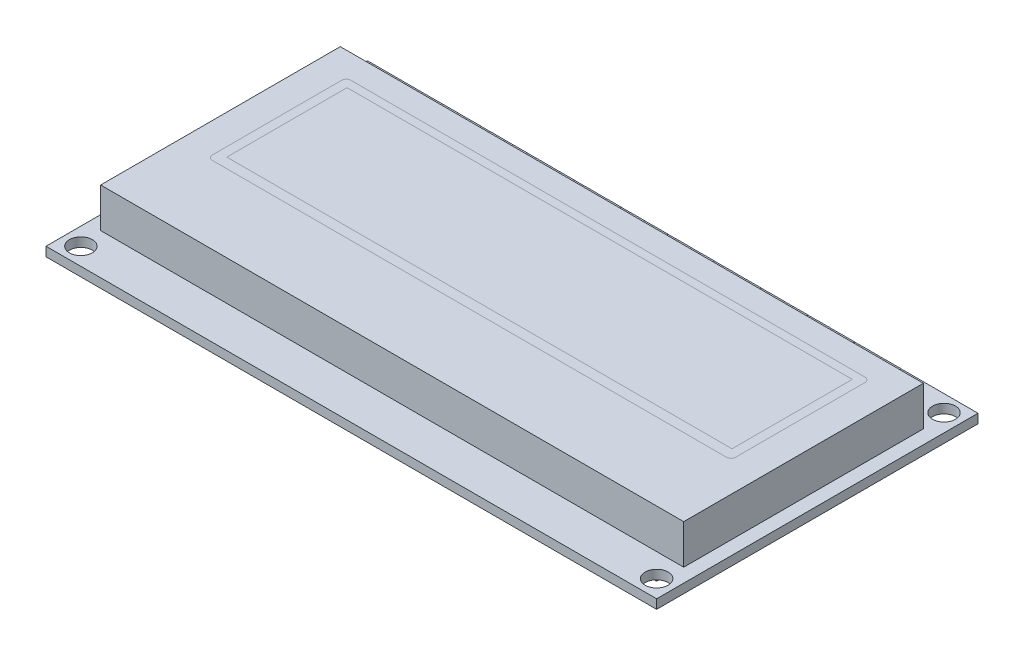
from build123d import *
from build123d.topology import SkipClean

# Parameters (mm, degrees)
SKETCH2_W                  = 66.5
SKETCH2_H                  = 35
BOSS_EXTRUDE1_DEPTH        = 0.5
F_2_5_2_5_DIAMETER_HOLE1_D = 2.5
F_0_8_0_8_DIAMETER_HOLE1_D = 0.8
SKETCH8_R                  = 0.4
BOSS_EXTRUDE2_DEPTH        = 0.01
LPATTERN1_COUNT            = 20
LPATTERN1_PITCH            = 2.54
MIRROR3_COPY_1_SKETCH_R    = 0.4
MIRROR3_COPY_1_DEPTH       = 0.01
MIRROR3_COPY_2_SKETCH_R    = 0.4
MIRROR3_COPY_2_DEPTH       = 0.01
MIRROR3_COPY_3_SKETCH_R    = 0.4
MIRROR3_COPY_3_DEPTH       = 0.01
MIRROR3_COPY_4_SKETCH_R    = 0.4
MIRROR3_COPY_4_DEPTH       = 0.01
MIRROR3_COPY_5_SKETCH_R    = 0.4
MIRROR3_COPY_5_DEPTH       = 0.01
MIRROR3_COPY_6_SKETCH_R    = 0.4
MIRROR3_COPY_6_DEPTH       = 0.01
MIRROR3_COPY_7_SKETCH_R    = 0.4
MIRROR3_COPY_7_DEPTH       = 0.01
MIRROR3_COPY_8_SKETCH_R    = 0.4
MIRROR3_COPY_8_DEPTH       = 0.01
MIRROR3_COPY_9_SKETCH_R    = 0.4
MIRROR3_COPY_9_DEPTH       = 0.01
MIRROR3_COPY_10_SKETCH_R   = 0.4
MIRROR3_COPY_10_DEPTH      = 0.01
MIRROR3_COPY_11_SKETCH_R   = 0.4
MIRROR3_COPY_11_DEPTH      = 0.01
MIRROR3_COPY_12_SKETCH_R   = 0.4
MIRROR3_COPY_12_DEPTH      = 0.01
MIRROR3_COPY_13_SKETCH_R   = 0.4
MIRROR3_COPY_13_DEPTH      = 0.01
MIRROR3_COPY_14_SKETCH_R   = 0.4
MIRROR3_COPY_14_DEPTH      = 0.01
MIRROR3_COPY_15_SKETCH_R   = 0.4
MIRROR3_COPY_15_DEPTH      = 0.01
MIRROR3_COPY_16_SKETCH_R   = 0.4
MIRROR3_COPY_16_DEPTH      = 0.01
MIRROR3_COPY_17_SKETCH_R   = 0.4
MIRROR3_COPY_17_DEPTH      = 0.01
MIRROR3_COPY_18_SKETCH_R   = 0.4
MIRROR3_COPY_18_DEPTH      = 0.01
MIRROR3_COPY_19_SKETCH_R   = 0.4
MIRROR3_COPY_19_DEPTH      = 0.01
SKETCH10_W                 = 63.5
SKETCH10_H                 = 26.1
BOSS_EXTRUDE3_DEPTH        = 4.3
SKETCH13_W                 = 56.2
SKETCH13_H                 = 24.45
BOSS_EXTRUDE4_DEPTH        = 2.5


with BuildPart() as part:
    # Sketch2 → Boss-Extrude1 (new, symmetric)
    with BuildSketch(Plane(origin=(0, 0, 0), x_dir=(1, 0, 0), z_dir=(0, 1, 0))):
        Rectangle(SKETCH2_W, SKETCH2_H)
    extrude(amount=BOSS_EXTRUDE1_DEPTH, both=True)

    # Ø2.5 (2.5) Diameter Hole1 (through all)
    with Locations(Plane(origin=(0, 0.5, 0), x_dir=(1, 0, 0), z_dir=(0, 1, 0))):
        with Locations((-31.35, -15.6), (-31.35, 15.7), (31.35, 15.7), (31.35, -15.6)):
            Hole(F_2_5_2_5_DIAMETER_HOLE1_D / 2)

    # Ø0.8 (0.8) Diameter Hole1 (through all)
    with Locations(Plane(origin=(0, 0.5, 0), x_dir=(1, 0, 0), z_dir=(0, 1, 0))):
        with Locations((-24.16, 14.9), (-21.62, 14.9), (-19.08, 14.9), (-16.54, 14.9), (-14, 14.9), (-11.46, 14.9), (-8.92, 14.9), (-6.38, 14.9), (-3.84, 14.9), (-1.3, 14.9), (1.24, 14.9), (3.78, 14.9), (6.32, 14.9), (8.86, 14.9), (11.4, 14.9), (13.94, 14.9), (16.48, 14.9), (19.02, 14.9), (21.56, 14.9), (24.1, 14.9)):
            Hole(F_0_8_0_8_DIAMETER_HOLE1_D / 2)

    # Sketch8 → Boss-Extrude2 (add)
    with SkipClean():  # the faces are left unmerged after this step: merging them gives an invalid solid
        with BuildSketch(Plane(origin=(0, 0.5, 0), x_dir=(1, 0, 0), z_dir=(0, 1, 0))):
            with BuildLine():
                Line((-24.96, 14.9), (-24.96, 17.5))
                Line((-24.96, 17.5), (-23.36, 17.5))
                Line((-23.36, 17.5), (-23.36, 14.9))
                ThreePointArc((-23.36, 14.9), (-24.16, 14.1), (-24.96, 14.9))
            make_face()
            with Locations((-24.16, 14.9)):
                Circle(SKETCH8_R, mode=Mode.SUBTRACT)
        boss_extrude2 = extrude(amount=BOSS_EXTRUDE2_DEPTH)
    add(part.part.scale(1), mode=Mode.REPLACE)  # the faces are merged on a copy

    # LPattern1: Boss-Extrude2 ×20
    with Locations(*[(i * LPATTERN1_PITCH, 0, 0) for i in range(1, LPATTERN1_COUNT)]):
        add(boss_extrude2)

    # Mirror3: Boss-Extrude2 across plane
    add(boss_extrude2.mirror(Plane.ZX))

    # Mirror3 copy 1 sketch → Mirror3 copy 1 (add)
    with BuildSketch(Plane(origin=(2.54, -0.5, 0), x_dir=(1, 0, 0), z_dir=(0, -1, 0))):
        with BuildLine():
            Line((-24.96, -14.9), (-24.96, -17.5))
            Line((-24.96, -17.5), (-23.36, -17.5))
            Line((-23.36, -17.5), (-23.36, -14.9))
            ThreePointArc((-23.36, -14.9), (-24.16, -14.1), (-24.96, -14.9))
        make_face()
        with Locations((-24.16, -14.9)):
            Circle(MIRROR3_COPY_1_SKETCH_R, mode=Mode.SUBTRACT)
    extrude(amount=MIRROR3_COPY_1_DEPTH)

    # Mirror3 copy 2 sketch → Mirror3 copy 2 (add)
    with BuildSketch(Plane(origin=(5.08, -0.5, 0), x_dir=(1, 0, 0), z_dir=(0, -1, 0))):
        with BuildLine():
            Line((-24.96, -14.9), (-24.96, -17.5))
            Line((-24.96, -17.5), (-23.36, -17.5))
            Line((-23.36, -17.5), (-23.36, -14.9))
            ThreePointArc((-23.36, -14.9), (-24.16, -14.1), (-24.96, -14.9))
        make_face()
        with Locations((-24.16, -14.9)):
            Circle(MIRROR3_COPY_2_SKETCH_R, mode=Mode.SUBTRACT)
    extrude(amount=MIRROR3_COPY_2_DEPTH)

    # Mirror3 copy 3 sketch → Mirror3 copy 3 (add)
    with BuildSketch(Plane(origin=(7.62, -0.5, 0), x_dir=(1, 0, 0), z_dir=(0, -1, 0))):
        with BuildLine():
            Line((-24.96, -14.9), (-24.96, -17.5))
            Line((-24.96, -17.5), (-23.36, -17.5))
            Line((-23.36, -17.5), (-23.36, -14.9))
            ThreePointArc((-23.36, -14.9), (-24.16, -14.1), (-24.96, -14.9))
        make_face()
        with Locations((-24.16, -14.9)):
            Circle(MIRROR3_COPY_3_SKETCH_R, mode=Mode.SUBTRACT)
    extrude(amount=MIRROR3_COPY_3_DEPTH)

    # Mirror3 copy 4 sketch → Mirror3 copy 4 (add)
    with BuildSketch(Plane(origin=(10.16, -0.5, 0), x_dir=(1, 0, 0), z_dir=(0, -1, 0))):
        with BuildLine():
            Line((-24.96, -14.9), (-24.96, -17.5))
            Line((-24.96, -17.5), (-23.36, -17.5))
            Line((-23.36, -17.5), (-23.36, -14.9))
            ThreePointArc((-23.36, -14.9), (-24.16, -14.1), (-24.96, -14.9))
        make_face()
        with Locations((-24.16, -14.9)):
            Circle(MIRROR3_COPY_4_SKETCH_R, mode=Mode.SUBTRACT)
    extrude(amount=MIRROR3_COPY_4_DEPTH)

    # Mirror3 copy 5 sketch → Mirror3 copy 5 (add)
    with BuildSketch(Plane(origin=(12.7, -0.5, 0), x_dir=(1, 0, 0), z_dir=(0, -1, 0))):
        with BuildLine():
            Line((-24.96, -14.9), (-24.96, -17.5))
            Line((-24.96, -17.5), (-23.36, -17.5))
            Line((-23.36, -17.5), (-23.36, -14.9))
            ThreePointArc((-23.36, -14.9), (-24.16, -14.1), (-24.96, -14.9))
        make_face()
        with Locations((-24.16, -14.9)):
            Circle(MIRROR3_COPY_5_SKETCH_R, mode=Mode.SUBTRACT)
    extrude(amount=MIRROR3_COPY_5_DEPTH)

    # Mirror3 copy 6 sketch → Mirror3 copy 6 (add)
    with BuildSketch(Plane(origin=(15.24, -0.5, 0), x_dir=(1, 0, 0), z_dir=(0, -1, 0))):
        with BuildLine():
            Line((-24.96, -14.9), (-24.96, -17.5))
            Line((-24.96, -17.5), (-23.36, -17.5))
            Line((-23.36, -17.5), (-23.36, -14.9))
            ThreePointArc((-23.36, -14.9), (-24.16, -14.1), (-24.96, -14.9))
        make_face()
        with Locations((-24.16, -14.9)):
            Circle(MIRROR3_COPY_6_SKETCH_R, mode=Mode.SUBTRACT)
    extrude(amount=MIRROR3_COPY_6_DEPTH)

    # Mirror3 copy 7 sketch → Mirror3 copy 7 (add)
    with BuildSketch(Plane(origin=(17.78, -0.5, 0), x_dir=(1, 0, 0), z_dir=(0, -1, 0))):
        with BuildLine():
            Line((-24.96, -14.9), (-24.96, -17.5))
            Line((-24.96, -17.5), (-23.36, -17.5))
            Line((-23.36, -17.5), (-23.36, -14.9))
            ThreePointArc((-23.36, -14.9), (-24.16, -14.1), (-24.96, -14.9))
        make_face()
        with Locations((-24.16, -14.9)):
            Circle(MIRROR3_COPY_7_SKETCH_R, mode=Mode.SUBTRACT)
    extrude(amount=MIRROR3_COPY_7_DEPTH)

    # Mirror3 copy 8 sketch → Mirror3 copy 8 (add)
    with BuildSketch(Plane(origin=(20.32, -0.5, 0), x_dir=(1, 0, 0), z_dir=(0, -1, 0))):
        with BuildLine():
            Line((-24.96, -14.9), (-24.96, -17.5))
            Line((-24.96, -17.5), (-23.36, -17.5))
            Line((-23.36, -17.5), (-23.36, -14.9))
            ThreePointArc((-23.36, -14.9), (-24.16, -14.1), (-24.96, -14.9))
        make_face()
        with Locations((-24.16, -14.9)):
            Circle(MIRROR3_COPY_8_SKETCH_R, mode=Mode.SUBTRACT)
    extrude(amount=MIRROR3_COPY_8_DEPTH)

    # Mirror3 copy 9 sketch → Mirror3 copy 9 (add)
    with BuildSketch(Plane(origin=(22.86, -0.5, 0), x_dir=(1, 0, 0), z_dir=(0, -1, 0))):
        with BuildLine():
            Line((-24.96, -14.9), (-24.96, -17.5))
            Line((-24.96, -17.5), (-23.36, -17.5))
            Line((-23.36, -17.5), (-23.36, -14.9))
            ThreePointArc((-23.36, -14.9), (-24.16, -14.1), (-24.96, -14.9))
        make_face()
        with Locations((-24.16, -14.9)):
            Circle(MIRROR3_COPY_9_SKETCH_R, mode=Mode.SUBTRACT)
    extrude(amount=MIRROR3_COPY_9_DEPTH)

    # Mirror3 copy 10 sketch → Mirror3 copy 10 (add)
    with BuildSketch(Plane(origin=(25.4, -0.5, 0), x_dir=(1, 0, 0), z_dir=(0, -1, 0))):
        with BuildLine():
            Line((-24.96, -14.9), (-24.96, -17.5))
            Line((-24.96, -17.5), (-23.36, -17.5))
            Line((-23.36, -17.5), (-23.36, -14.9))
            ThreePointArc((-23.36, -14.9), (-24.16, -14.1), (-24.96, -14.9))
        make_face()
        with Locations((-24.16, -14.9)):
            Circle(MIRROR3_COPY_10_SKETCH_R, mode=Mode.SUBTRACT)
    extrude(amount=MIRROR3_COPY_10_DEPTH)

    # Mirror3 copy 11 sketch → Mirror3 copy 11 (add)
    with BuildSketch(Plane(origin=(27.94, -0.5, 0), x_dir=(1, 0, 0), z_dir=(0, -1, 0))):
        with BuildLine():
            Line((-24.96, -14.9), (-24.96, -17.5))
            Line((-24.96, -17.5), (-23.36, -17.5))
            Line((-23.36, -17.5), (-23.36, -14.9))
            ThreePointArc((-23.36, -14.9), (-24.16, -14.1), (-24.96, -14.9))
        make_face()
        with Locations((-24.16, -14.9)):
            Circle(MIRROR3_COPY_11_SKETCH_R, mode=Mode.SUBTRACT)
    extrude(amount=MIRROR3_COPY_11_DEPTH)

    # Mirror3 copy 12 sketch → Mirror3 copy 12 (add)
    with BuildSketch(Plane(origin=(30.48, -0.5, 0), x_dir=(1, 0, 0), z_dir=(0, -1, 0))):
        with BuildLine():
            Line((-24.96, -14.9), (-24.96, -17.5))
            Line((-24.96, -17.5), (-23.36, -17.5))
            Line((-23.36, -17.5), (-23.36, -14.9))
            ThreePointArc((-23.36, -14.9), (-24.16, -14.1), (-24.96, -14.9))
        make_face()
        with Locations((-24.16, -14.9)):
            Circle(MIRROR3_COPY_12_SKETCH_R, mode=Mode.SUBTRACT)
    extrude(amount=MIRROR3_COPY_12_DEPTH)

    # Mirror3 copy 13 sketch → Mirror3 copy 13 (add)
    with BuildSketch(Plane(origin=(33.02, -0.5, 0), x_dir=(1, 0, 0), z_dir=(0, -1, 0))):
        with BuildLine():
            Line((-24.96, -14.9), (-24.96, -17.5))
            Line((-24.96, -17.5), (-23.36, -17.5))
            Line((-23.36, -17.5), (-23.36, -14.9))
            ThreePointArc((-23.36, -14.9), (-24.16, -14.1), (-24.96, -14.9))
        make_face()
        with Locations((-24.16, -14.9)):
            Circle(MIRROR3_COPY_13_SKETCH_R, mode=Mode.SUBTRACT)
    extrude(amount=MIRROR3_COPY_13_DEPTH)

    # Mirror3 copy 14 sketch → Mirror3 copy 14 (add)
    with BuildSketch(Plane(origin=(35.56, -0.5, 0), x_dir=(1, 0, 0), z_dir=(0, -1, 0))):
        with BuildLine():
            Line((-24.96, -14.9), (-24.96, -17.5))
            Line((-24.96, -17.5), (-23.36, -17.5))
            Line((-23.36, -17.5), (-23.36, -14.9))
            ThreePointArc((-23.36, -14.9), (-24.16, -14.1), (-24.96, -14.9))
        make_face()
        with Locations((-24.16, -14.9)):
            Circle(MIRROR3_COPY_14_SKETCH_R, mode=Mode.SUBTRACT)
    extrude(amount=MIRROR3_COPY_14_DEPTH)

    # Mirror3 copy 15 sketch → Mirror3 copy 15 (add)
    with BuildSketch(Plane(origin=(38.1, -0.5, 0), x_dir=(1, 0, 0), z_dir=(0, -1, 0))):
        with BuildLine():
            Line((-24.96, -14.9), (-24.96, -17.5))
            Line((-24.96, -17.5), (-23.36, -17.5))
            Line((-23.36, -17.5), (-23.36, -14.9))
            ThreePointArc((-23.36, -14.9), (-24.16, -14.1), (-24.96, -14.9))
        make_face()
        with Locations((-24.16, -14.9)):
            Circle(MIRROR3_COPY_15_SKETCH_R, mode=Mode.SUBTRACT)
    extrude(amount=MIRROR3_COPY_15_DEPTH)

    # Mirror3 copy 16 sketch → Mirror3 copy 16 (add)
    with BuildSketch(Plane(origin=(40.64, -0.5, 0), x_dir=(1, 0, 0), z_dir=(0, -1, 0))):
        with BuildLine():
            Line((-24.96, -14.9), (-24.96, -17.5))
            Line((-24.96, -17.5), (-23.36, -17.5))
            Line((-23.36, -17.5), (-23.36, -14.9))
            ThreePointArc((-23.36, -14.9), (-24.16, -14.1), (-24.96, -14.9))
        make_face()
        with Locations((-24.16, -14.9)):
            Circle(MIRROR3_COPY_16_SKETCH_R, mode=Mode.SUBTRACT)
    extrude(amount=MIRROR3_COPY_16_DEPTH)

    # Mirror3 copy 17 sketch → Mirror3 copy 17 (add)
    with BuildSketch(Plane(origin=(43.18, -0.5, 0), x_dir=(1, 0, 0), z_dir=(0, -1, 0))):
        with BuildLine():
            Line((-24.96, -14.9), (-24.96, -17.5))
            Line((-24.96, -17.5), (-23.36, -17.5))
            Line((-23.36, -17.5), (-23.36, -14.9))
            ThreePointArc((-23.36, -14.9), (-24.16, -14.1), (-24.96, -14.9))
        make_face()
        with Locations((-24.16, -14.9)):
            Circle(MIRROR3_COPY_17_SKETCH_R, mode=Mode.SUBTRACT)
    extrude(amount=MIRROR3_COPY_17_DEPTH)

    # Mirror3 copy 18 sketch → Mirror3 copy 18 (add)
    with BuildSketch(Plane(origin=(45.72, -0.5, 0), x_dir=(1, 0, 0), z_dir=(0, -1, 0))):
        with BuildLine():
            Line((-24.96, -14.9), (-24.96, -17.5))
            Line((-24.96, -17.5), (-23.36, -17.5))
            Line((-23.36, -17.5), (-23.36, -14.9))
            ThreePointArc((-23.36, -14.9), (-24.16, -14.1), (-24.96, -14.9))
        make_face()
        with Locations((-24.16, -14.9)):
            Circle(MIRROR3_COPY_18_SKETCH_R, mode=Mode.SUBTRACT)
    extrude(amount=MIRROR3_COPY_18_DEPTH)

    # Mirror3 copy 19 sketch → Mirror3 copy 19 (add)
    with SkipClean():  # the faces are left unmerged after this step: merging them gives an invalid solid
        with BuildSketch(Plane(origin=(48.26, -0.5, 0), x_dir=(1, 0, 0), z_dir=(0, -1, 0))):
            with BuildLine():
                Line((-24.96, -14.9), (-24.96, -17.5))
                Line((-24.96, -17.5), (-23.36, -17.5))
                Line((-23.36, -17.5), (-23.36, -14.9))
                ThreePointArc((-23.36, -14.9), (-24.16, -14.1), (-24.96, -14.9))
            make_face()
            with Locations((-24.16, -14.9)):
                Circle(MIRROR3_COPY_19_SKETCH_R, mode=Mode.SUBTRACT)
        extrude(amount=MIRROR3_COPY_19_DEPTH)
    add(part.part.scale(1), mode=Mode.REPLACE)  # the faces are merged on a copy

    # Sketch10 → Boss-Extrude3 (add)
    with BuildSketch(Plane(origin=(0, 0.5, 0), x_dir=(1, 0, 0), z_dir=(0, 1, 0))):
        Rectangle(SKETCH10_W, SKETCH10_H)
    extrude(amount=BOSS_EXTRUDE3_DEPTH)

    # Sketch13 → Boss-Extrude4 (add)
    with BuildSketch(Plane.XZ.offset(0.5)):
        with Locations((0, 0.125)):
            Rectangle(SKETCH13_W, SKETCH13_H)
    extrude(amount=BOSS_EXTRUDE4_DEPTH)


solid = part.part
